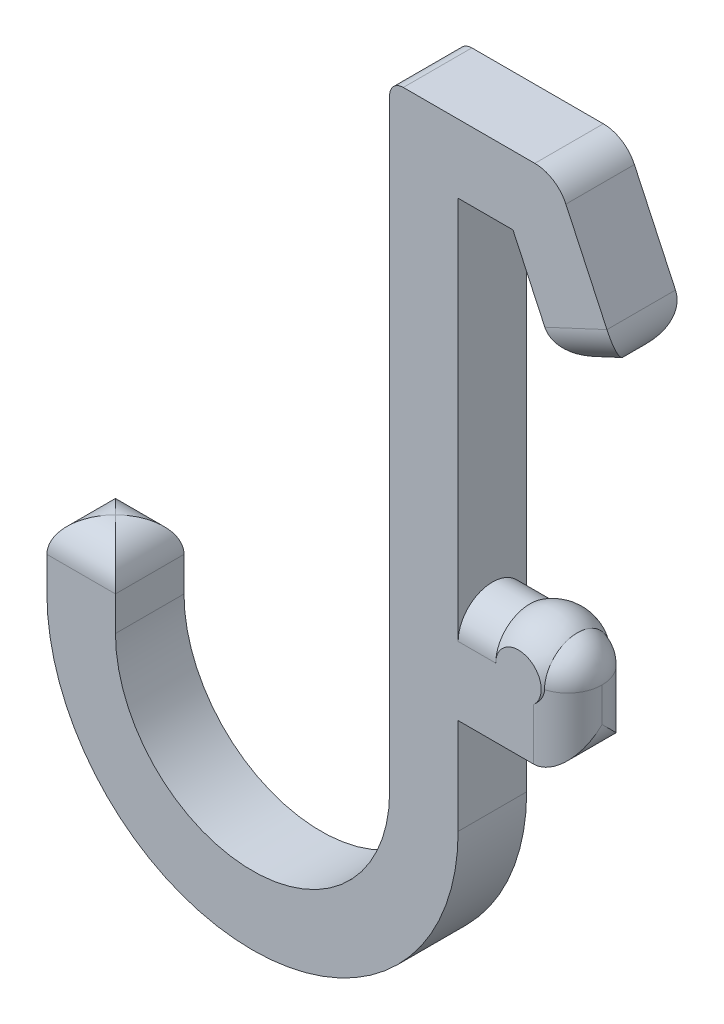
from build123d import *

# Parameters (mm, degrees)
EXTRUDE_1_DEPTH     = 5
FILLET_1_R          = 2.5
FILLET_2_R          = 1
EXTRUDE_2_DEPTH     = 8
FILLET_3_R          = 2.5
SKETCH_5_W          = 1.467751534
SKETCH_5_H          = 4.178210798
SKETCH_5_W_2        = 1.389566385
CUT_EXTRUDE_1_DEPTH = 20


with BuildPart() as part:
    # 草图1 → 凸台-拉伸1 (new body)
    with BuildSketch(Plane.XY):
        with BuildLine():
            Line((0, 0), (0, 28))
            Line((0, 28), (4, 28))
            Line((4, 28), (7.380946094, 20.749537704))
            Line((7.380946094, 20.749537704), (11.912485029, 22.862629012))
            Line((11.912485029, 22.862629012), (7.185351304, 33))
            Line((7.185351304, 33), (-5, 33))
            Line((-5, 33), (-5, -12))
            ThreePointArc((-5, -12), (-15, -22), (-25, -12))
            Line((-25, -12), (-25, -7))
            Line((-25, -7), (-30, -7))
            Line((-30, -7), (-30, -12))
            ThreePointArc((-30, -12), (-15, -27), (0, -12))
            Line((0, -12), (0, -5))
            Line((0, -5), (8, -5))
            Line((8, -5), (8, 0))
            Line((8, 0), (0, 0))
        make_face()
    extrude(amount=EXTRUDE_1_DEPTH)

    # 圆角1
    fillet_1_edges = [part.edges().sort_by_distance(p)[0] for p in [
        (-27.5, -7, 0),
        (9.646715562, 21.806083358, 0),
        (9.646715562, 21.806083358, 5),
        (-30, -7, 2.5),
        (-25, -7, 2.5),
        (7.185351304, 33, 2.5),
        (11.912485029, 22.862629012, 2.5),
        (7.380946094, 20.749537704, 2.5),
        (-27.5, -7, 5),
    ]]
    fillet(fillet_1_edges, radius=FILLET_1_R - 0.0001)  # a hair under: the kernel refuses the full size

    # 圆角2
    fillet_2_edges = [part.edges().sort_by_distance(p)[0] for p in [
        (-5, 33, 2.5),
    ]]
    fillet(fillet_2_edges, radius=FILLET_2_R)

    # 草图3 → 凸台-拉伸2 (add)
    with BuildSketch(Plane(origin=(0, 0, 0), x_dir=(0, 0, -1), z_dir=(1, 0, 0))):
        with BuildLine():
            Line((-5, 0), (0, 0))
            ThreePointArc((0, 0), (-2.5, 2.5), (-5, 0))
        make_face()
    extrude(amount=EXTRUDE_2_DEPTH)

    # 圆角3
    fillet_3_edges = [part.edges().sort_by_distance(p)[0] for p in [
        (8, -2.5, 0),
        (8, -5, 2.5),
        (8, -2.5, 5),
        (8, 2.5, 2.5),
    ]]
    fillet(fillet_3_edges, radius=FILLET_3_R - 0.0001)  # a hair under: the kernel refuses the full size

    # 草图4 → 旋转3 (revolve)
    with BuildSketch(Plane(origin=(4.4, 0, 0), x_dir=(0, 0, -1), z_dir=(1, 0, 0))):
        with BuildLine():
            Line((-5.5, 0), (0.5, 0))
            ThreePointArc((0.5, 0), (-2.5, 3), (-5.5, 0))
        make_face()
    revolve(axis=Axis((4.4, 0, 2.5), (0, 0, -1)))

    # 草图5 → 切除-拉伸1 (cut)
    with BuildSketch(Plane.ZY.offset(5)):
        with Locations((-0.733875767, -0.010051234)):
            Rectangle(SKETCH_5_W, SKETCH_5_H)
        with Locations((5.694783193, -0.010051234)):
            Rectangle(SKETCH_5_W_2, SKETCH_5_H)
    extrude(amount=-CUT_EXTRUDE_1_DEPTH, mode=Mode.SUBTRACT)


solid = part.part
